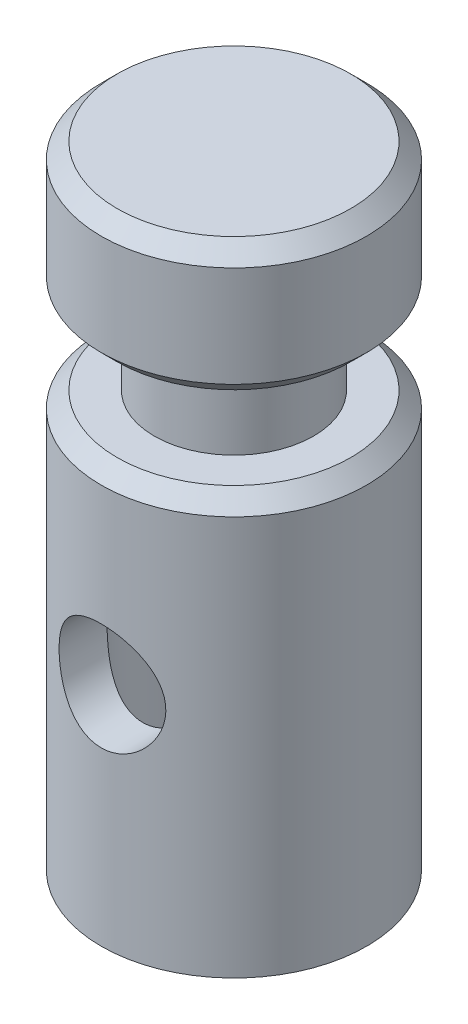
from build123d import *

# Parameters (mm, degrees)
SKETCH1_R           = 12.7
BOSS_EXTRUDE1_DEPTH = 39.751
SKETCH2_R           = 8.73125
CUT_EXTRUDE1_DEPTH  = 30.226
SKETCH4_R           = 7.62
BOSS_EXTRUDE2_DEPTH = 6.35
SKETCH5_R           = 3.175
BOSS_EXTRUDE3_DEPTH = 1.5875
SKETCH7_R           = 12.7
BOSS_EXTRUDE4_DEPTH = 12.7
CHAMFER1_SIZE       = 1.524


# Read off the part's stored shape, not the designer's step: 1/8 NPT Tapped Hole1
with BuildPart() as part:
    # Sketch1 → Boss-Extrude1 (new body)
    with BuildSketch(Plane(origin=(0, 0, 0), x_dir=(1, 0, 0), z_dir=(0, 1, 0))):
        with Locations(Location((0, 0, 0), (0, 0, 270))):
            Circle(SKETCH1_R)
    extrude(amount=BOSS_EXTRUDE1_DEPTH)

    # Sketch2 → Cut-Extrude1 (cut)
    with BuildSketch(Plane.XZ):
        with Locations(Location((0, 0, 0), (0, 0, 270))):
            Circle(SKETCH2_R)
    extrude(amount=-CUT_EXTRUDE1_DEPTH, mode=Mode.SUBTRACT)

    # Sketch4 → Boss-Extrude2 (add)
    with BuildSketch(Plane(origin=(0, 39.751, 0), x_dir=(1, 0, 0), z_dir=(0, 1, 0))):
        with Locations(Location((0, 0, 0), (0, 0, 270))):
            Circle(SKETCH4_R)
    extrude(amount=BOSS_EXTRUDE2_DEPTH)

    # Sketch5 → Boss-Extrude3 (add)
    with BuildSketch(Plane(origin=(0, 46.101, 0), x_dir=(1, 0, 0), z_dir=(0, 1, 0))):
        with Locations(Location((0, 0, 0), (0, 0, 270))):
            Circle(SKETCH5_R)
    extrude(amount=BOSS_EXTRUDE3_DEPTH)

    # Sketch7 → Boss-Extrude4 (add)
    with BuildSketch(Plane(origin=(0, 47.6885, 0), x_dir=(1, 0, 0), z_dir=(0, 1, 0))):
        with Locations(Location((0, 0, 0), (0, 0, 270))):
            Circle(SKETCH7_R)
    extrude(amount=BOSS_EXTRUDE4_DEPTH)

    # Chamfer1
    chamfer1_edges = [part.edges().sort_by_distance(p)[0] for p in [
        (0, 47.6885, -12.7),
        (0, 60.3885, -12.7),
        (0, 39.751, -12.7),
    ]]
    chamfer(chamfer1_edges, length=CHAMFER1_SIZE)

    # 1/8 NPT Tapped Hole1 outline → 1/8 NPT Tapped Hole1 (revolve, cut)
    with BuildSketch(Plane.XZ.offset(-21.59)):
        Polygon((5.141518805, 12.700000181), (0, 12.700000181), (0, 7.174156466), (4.976067645, 7.174156466), align=None)
    revolve(axis=Axis((0, 21.59, 0), (0, 0, 1)), mode=Mode.SUBTRACT)


solid = part.part
